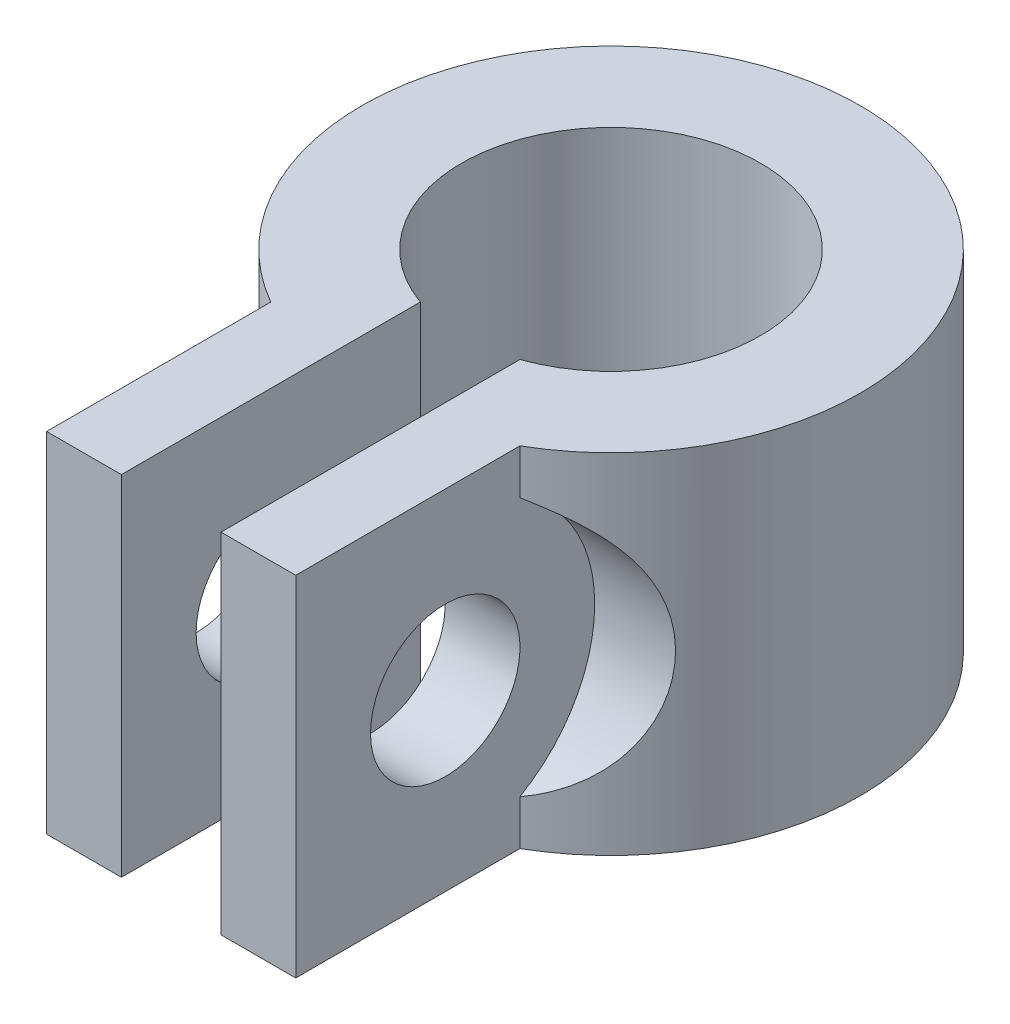
from build123d import *

# Parameters (mm, degrees)
SKETCH1_R               = 5
SKETCH1_R_2             = 3
BOSS_EXTRUDE1_DEPTH     = 7
SKETCH2_W               = 2
SKETCH2_H               = 5.830742268
CUT_EXTRUDE1_DEPTH      = 8
SKETCH3_W               = 6
SKETCH3_H               = 7
BOSS_EXTRUDE2_DEPTH     = 1.5
CUT_EXTRUDE2_DEPTH      = 13.764839423
CUT_EXTRUDE2_DEPTH_BACK = 13.764839423
SKETCH4_R               = 1.5
SKETCH5_R               = 3
CUT_EXTRUDE3_DEPTH      = 14.534811724


with BuildPart() as part:
    # Sketch1 → Boss-Extrude1 (new body)
    with BuildSketch(Plane(origin=(0, 0, 0), x_dir=(1, 0, 0), z_dir=(0, 1, 0))):
        Circle(SKETCH1_R)
        Circle(SKETCH1_R_2, mode=Mode.SUBTRACT)
    extrude(amount=BOSS_EXTRUDE1_DEPTH)

    # Sketch2 → Cut-Extrude1 (cut)
    with BuildSketch(Plane(origin=(0, 7, 0), x_dir=(1, 0, 0), z_dir=(0, 1, 0))):
        with Locations((0, -3.925683868)):
            Rectangle(SKETCH2_W, SKETCH2_H)
    extrude(amount=-CUT_EXTRUDE1_DEPTH, mode=Mode.SUBTRACT)

    # Sketch3 → Boss-Extrude2 (add)
    with BuildSketch(Plane(origin=(-1, 0, 0), x_dir=(0, 0, -1), z_dir=(1, 0, 0))):
        with Locations((-5.828427125, 3.5)):
            Rectangle(SKETCH3_W, SKETCH3_H)
    boss_extrude2 = extrude(amount=-BOSS_EXTRUDE2_DEPTH)

    # Mirror1: Boss-Extrude2 across plane
    add(boss_extrude2.mirror(Plane(origin=(0, 0, 0), x_dir=(0, 0, 1), z_dir=(1, 0, 0))))

    # Sketch4 → Cut-Extrude2 (cut, two sides: drawn at the far end of the back side and taken through both)
    with BuildSketch(Plane.ZY.offset(-1).offset(-CUT_EXTRUDE2_DEPTH_BACK)):
        with Locations((5.828427125, 3.5)):
            Circle(SKETCH4_R)
    extrude(amount=CUT_EXTRUDE2_DEPTH + CUT_EXTRUDE2_DEPTH_BACK, mode=Mode.SUBTRACT)

    # Sketch5 → Cut-Extrude3 (cut, through all)
    with BuildSketch(Plane.ZY.offset(2.5)):
        with Locations((5.828427125, 3.5)):
            Circle(SKETCH5_R)
    cut_extrude3 = extrude(amount=CUT_EXTRUDE3_DEPTH, mode=Mode.SUBTRACT)

    # Mirror2: Cut-Extrude3 across plane
    add(cut_extrude3.mirror(Plane(origin=(0, 0, 0), x_dir=(0, 0, 1), z_dir=(1, 0, 0))), mode=Mode.SUBTRACT)


solid = part.part
